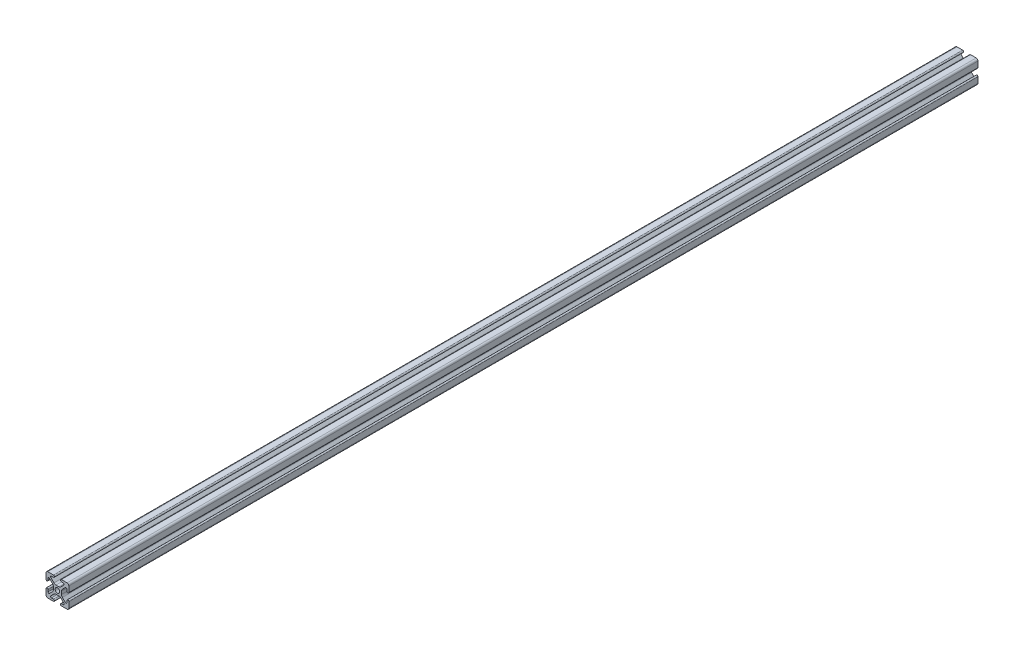
from build123d import *

# Parameters (mm, degrees)
SKETCH1_R      = 2.5
EXTRUDE1_DEPTH = 996.064


with BuildPart() as part:
    # Sketch1 → Extrude1 (new body)
    with BuildSketch(Plane.XY):
        with BuildLine():
            Line((-8.636346088, 7.111588351), (-5.432204773, 3.912143135))
            ThreePointArc((-5.432204773, 3.912143135), (-4.708985779, 2.831057106), (-4.455, 1.555406707))
            Line((-4.455, 1.555406707), (-4.455, -1.555406707))
            ThreePointArc((-4.455, -1.555406707), (-4.708985779, -2.831057106), (-5.432204773, -3.912143135))
            Line((-5.432204773, -3.912143135), (-8.636346088, -7.111588351))
            ThreePointArc((-8.636346088, -7.111588351), (-9.736852394, -7.329863489), (-10.36, -6.396886949))
            Line((-10.36, -6.396886949), (-10.36, -4.32))
            ThreePointArc((-10.36, -4.32), (-11.43, -3.25), (-12.5, -4.32))
            Line((-12.5, -4.32), (-12.5, -8.651801989))
            Line((-12.5, -8.651801989), (-12.5, -10.537068835))
            ThreePointArc((-12.5, -10.537068835), (-11.925070773, -11.925070773), (-10.537068835, -12.5))
            Line((-10.537068835, -12.5), (-8.441567612, -12.5))
            Line((-8.441567612, -12.5), (-4.387856959, -12.5))
            ThreePointArc((-4.387856959, -12.5), (-3.317856959, -11.43), (-4.387856959, -10.36))
            Line((-4.387856959, -10.36), (-6.42, -10.36))
            ThreePointArc((-6.42, -10.36), (-7.35325999, -9.736168088), (-7.133653912, -8.635298598))
            Line((-7.133653912, -8.635298598), (-3.795290766, -5.301828272))
            ThreePointArc((-3.795290766, -5.301828272), (-2.76743922, -4.61585726), (-1.555406707, -4.375))
            Line((-1.555406707, -4.375), (1.555406707, -4.375))
            ThreePointArc((1.555406707, -4.375), (2.76743922, -4.61585726), (3.795290766, -5.301828272))
            Line((3.795290766, -5.301828272), (7.133653912, -8.635298598))
            ThreePointArc((7.133653912, -8.635298598), (7.35325999, -9.736168088), (6.42, -10.36))
            Line((6.42, -10.36), (4.387856959, -10.36))
            ThreePointArc((4.387856959, -10.36), (3.317856959, -11.43), (4.387856959, -12.5))
            Line((4.387856959, -12.5), (8.441567612, -12.5))
            Line((8.441567612, -12.5), (10.537068835, -12.5))
            ThreePointArc((10.537068835, -12.5), (11.925070773, -11.925070773), (12.5, -10.537068835))
            Line((12.5, -10.537068835), (12.5, -8.651801989))
            Line((12.5, -8.651801989), (12.5, -4.32))
            ThreePointArc((12.5, -4.32), (11.43, -3.25), (10.36, -4.32))
            Line((10.36, -4.32), (10.36, -6.396886949))
            ThreePointArc((10.36, -6.396886949), (9.736852394, -7.329863489), (8.636346088, -7.111588351))
            Line((8.636346088, -7.111588351), (5.432204773, -3.912143135))
            ThreePointArc((5.432204773, -3.912143135), (4.708985779, -2.831057106), (4.455, -1.555406707))
            Line((4.455, -1.555406707), (4.455, 1.555406707))
            ThreePointArc((4.455, 1.555406707), (4.708985779, 2.831057106), (5.432204773, 3.912143135))
            Line((5.432204773, 3.912143135), (8.636346088, 7.111588351))
            ThreePointArc((8.636346088, 7.111588351), (9.736852394, 7.329863489), (10.36, 6.396886949))
            Line((10.36, 6.396886949), (10.36, 4.32))
            ThreePointArc((10.36, 4.32), (11.43, 3.25), (12.5, 4.32))
            Line((12.5, 4.32), (12.5, 7.99129648))
            Line((12.5, 7.99129648), (12.5, 10.537068835))
            ThreePointArc((12.5, 10.537068835), (11.925070773, 11.925070773), (10.537068835, 12.5))
            Line((10.537068835, 12.5), (4.32, 12.5))
            ThreePointArc((4.32, 12.5), (3.25, 11.43), (4.32, 10.36))
            Line((4.32, 10.36), (6.42, 10.36))
            ThreePointArc((6.42, 10.36), (7.35325999, 9.736168088), (7.133653912, 8.635298598))
            Line((7.133653912, 8.635298598), (3.795290766, 5.301828272))
            ThreePointArc((3.795290766, 5.301828272), (2.76743922, 4.61585726), (1.555406707, 4.375))
            Line((1.555406707, 4.375), (-1.555406707, 4.375))
            ThreePointArc((-1.555406707, 4.375), (-2.76743922, 4.61585726), (-3.795290766, 5.301828272))
            Line((-3.795290766, 5.301828272), (-7.133653912, 8.635298598))
            ThreePointArc((-7.133653912, 8.635298598), (-7.35325999, 9.736168088), (-6.42, 10.36))
            Line((-6.42, 10.36), (-4.32, 10.36))
            ThreePointArc((-4.32, 10.36), (-3.25, 11.43), (-4.32, 12.5))
            Line((-4.32, 12.5), (-10.537068835, 12.5))
            ThreePointArc((-10.537068835, 12.5), (-11.925070773, 11.925070773), (-12.5, 10.537068835))
            Line((-12.5, 10.537068835), (-12.5, 7.99129648))
            Line((-12.5, 7.99129648), (-12.5, 4.32))
            ThreePointArc((-12.5, 4.32), (-11.43, 3.25), (-10.36, 4.32))
            Line((-10.36, 4.32), (-10.36, 6.396886949))
            ThreePointArc((-10.36, 6.396886949), (-9.736852394, 7.329863489), (-8.636346088, 7.111588351))
        make_face()
        Circle(SKETCH1_R, mode=Mode.SUBTRACT)
    extrude(amount=-EXTRUDE1_DEPTH)


solid = part.part
